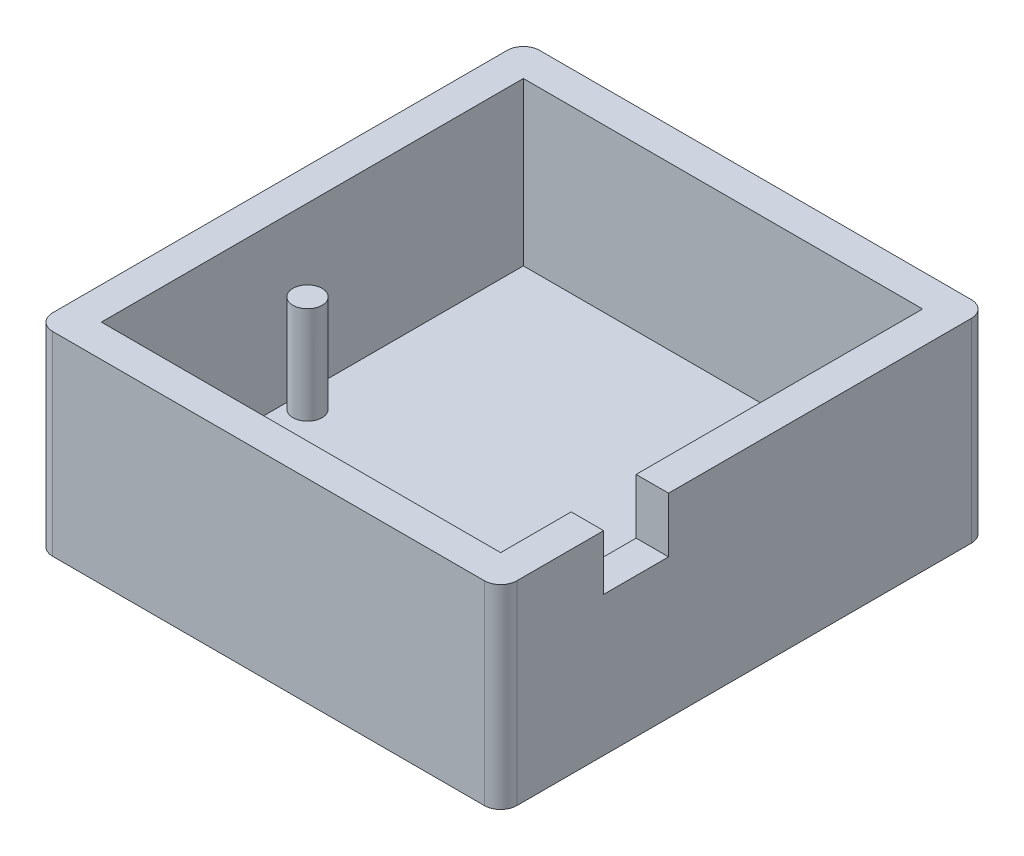
from build123d import *

# Parameters (mm, degrees)
ESQUISSE1_W          = 49.2
ESQUISSE1_H          = 52
BOSS_EXTRU_1_DEPTH   = 20
COQUE1_T             = 4
CONG_1_R             = 2
CONG_2_R             = 2
CONG_3_R             = 2
CONG_4_R             = 2
ESQUISSE5_R          = 1.8
BOSS_EXTRU_2_DEPTH   = 12
EMPREINTE1_START     = 9.306734089
EMPREINTE1_OUTLINE_W = 4
EMPREINTE1_OUTLINE_H = 6.8
EMPREINTE1_DEPTH     = 8


# Read off the part's stored shape, not the designer's step: Empreinte1
with BuildPart() as part:
    # Esquisse1 → Boss.-Extru.1 (new body)
    with BuildSketch(Plane(origin=(0, 0, 0), x_dir=(1, 0, 0), z_dir=(0, 1, 0))):
        Rectangle(ESQUISSE1_W, ESQUISSE1_H)
    extrude(amount=BOSS_EXTRU_1_DEPTH)

    # Coque1
    coque1_openings = [part.faces().sort_by_distance(p)[0] for p in [
        (0, 20, 0),
    ]]
    offset(amount=COQUE1_T, openings=coque1_openings, kind=Kind.INTERSECTION)

    # Congé1
    # the kernel refuses this fillet: 2 mm, written as the material it takes off along each edge
    with BuildSketch(Plane(origin=(28.6, -9, 30), x_dir=(-1, 0, 0), z_dir=(0, 1, 0))) as cong_1_piece_1:
        with BuildLine():
            CenterArc((CONG_1_R, -CONG_1_R), CONG_1_R, 90, 90)
            Line((0, -CONG_1_R), (0, 0))
            Line((0, 0), (CONG_1_R, 0))
        make_face()
    extrude(amount=34, mode=Mode.SUBTRACT)

    # Congé2
    cong_2_edges = [part.edges().sort_by_distance(p)[0] for p in [
        (28.6, 8, -30),
    ]]
    fillet(cong_2_edges, radius=CONG_2_R)

    # Congé3
    cong_3_edges = [part.edges().sort_by_distance(p)[0] for p in [
        (-28.6, 8, -30),
    ]]
    fillet(cong_3_edges, radius=CONG_3_R)

    # Congé4
    cong_4_edges = [part.edges().sort_by_distance(p)[0] for p in [
        (-28.6, 8, 30),
    ]]
    fillet(cong_4_edges, radius=CONG_4_R)

    # Esquisse5 → Boss.-Extru.2 (add)
    with BuildSketch(Plane(origin=(0, 0, 0), x_dir=(1, 0, 0), z_dir=(0, 1, 0))):
        with Locations(Location((-22.6, -2.6, 0), (0, 0, 90))):
            Circle(ESQUISSE5_R)
        with Locations(Location((22.6, -2.6, 0), (0, 0, 90))):
            Circle(ESQUISSE5_R)
        with Locations(Location((-22.6, -24, 0), (0, 0, 90))):
            Circle(ESQUISSE5_R)
        with Locations(Location((22.6, -24, 0), (0, 0, 90))):
            Circle(ESQUISSE5_R)
    extrude(amount=BOSS_EXTRU_2_DEPTH)

    # Empreinte1 outline → Empreinte1 (cut)
    with BuildSketch(Plane.XY.offset(EMPREINTE1_START)):
        with Locations((26.6, 16.6)):
            Rectangle(EMPREINTE1_OUTLINE_W, EMPREINTE1_OUTLINE_H)
    extrude(amount=EMPREINTE1_DEPTH, mode=Mode.SUBTRACT)


solid = part.part
